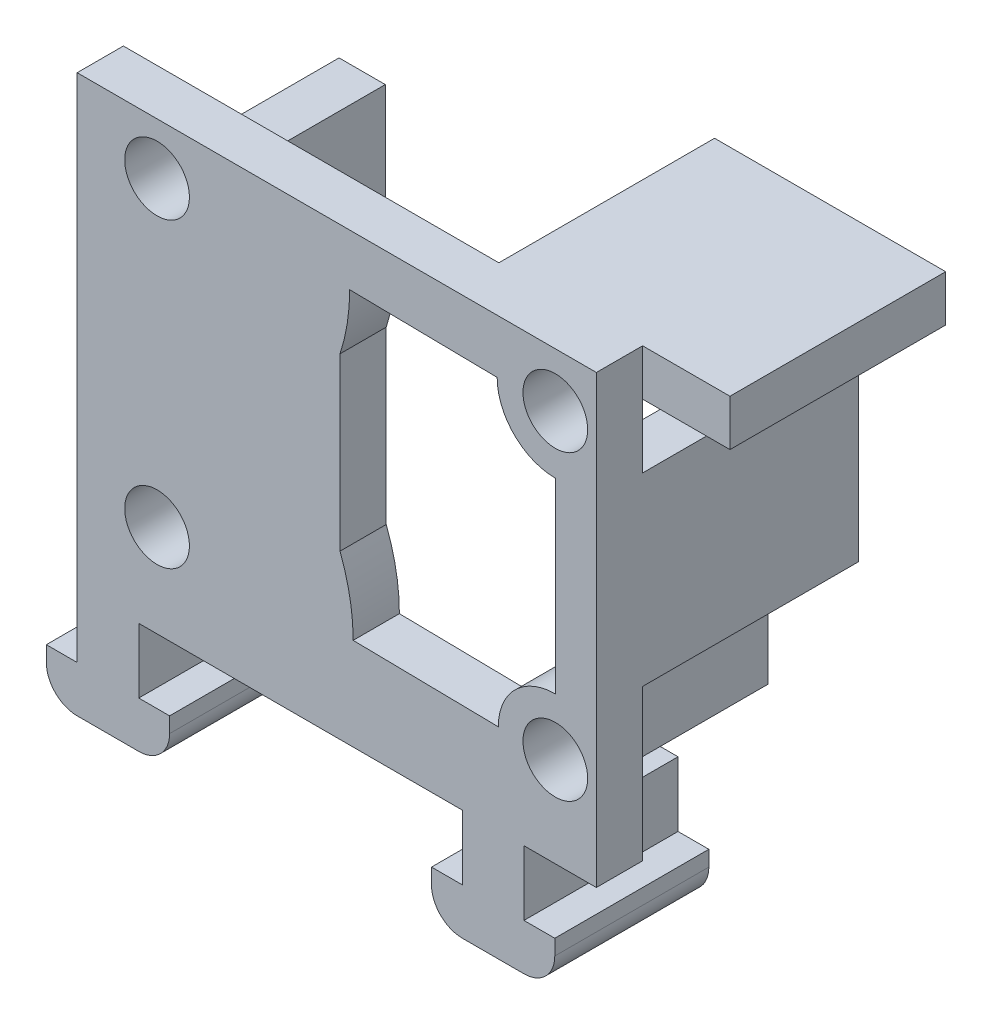
from build123d import *

# Parameters (mm, degrees)
EXTRUDE_1_DEPTH      = 2
EXTRUDE_1_DEPTH_BACK = 1
SKETCH_2_R           = 2.1
SKETCH_10_W          = 15
SKETCH_10_H          = 3
SKETCH_10_W_2        = 3
SKETCH_10_H_2        = 12
SKETCH_10_H_3        = 11.479623975
EXTRUDE_4_DEPTH      = 14
BOSS_EXTRUDE1_DEPTH  = 10
LPATTERN1_COUNT      = 2
LPATTERN1_PITCH      = 25
SKETCH2_W            = 3
SKETCH2_H            = 4
BOSS_EXTRUDE2_DEPTH  = 14
BOSS_EXTRUDE3_DEPTH  = 4
LPATTERN2_COUNT      = 2
LPATTERN2_PITCH      = 25


with BuildPart() as part:
    # Эскиз2 → Бобышка-Вытянуть1 (new, two sides: drawn at the far end of the back side and taken through both)
    with BuildSketch(Plane.XY.offset(-EXTRUDE_1_DEPTH_BACK)):
        Polygon((-17.059831088, 0), (-17.059831088, -2.25), (16.640168912, -2.25), (16.640168912, 0), (16.640168912, 26.7), (-17.059831088, 26.7), align=None)
        with Locations((13.974594116, 3.601530827)):
            Circle(SKETCH_2_R, mode=Mode.SUBTRACT)
        with Locations((13.974594116, 23.201353662)):
            Circle(SKETCH_2_R, mode=Mode.SUBTRACT)
        with Locations((-11.873187325, 23.347253317)):
            Circle(SKETCH_2_R, mode=Mode.SUBTRACT)
        with Locations((-11.873187325, 3.749999419)):
            Circle(SKETCH_2_R, mode=Mode.SUBTRACT)
        with BuildLine():
            Line((0, 19.427331525), (0, 8.33481378))
            ThreePointArc((0, 8.33481378), (0.6390244, 6.081878002), (0.854463675, 3.749999419))
            Line((0.854463675, 3.749999419), (10.273173279, 3.601530827))
            ThreePointArc((10.273173279, 3.601530827), (11.357294342, 6.218830601), (13.974594116, 7.302951664))
            Line((13.974594116, 7.302951664), (13.974594116, 19.427331525))
            ThreePointArc((13.974594116, 19.427331525), (11.305957471, 20.532717016), (10.200571979, 23.201353662))
            Line((10.200571979, 23.201353662), (0.63034674, 23.347253317))
            ThreePointArc((0.63034674, 23.347253317), (0.471754276, 21.36211328), (0, 19.427331525))
        make_face(mode=Mode.SUBTRACT)
    extrude(amount=EXTRUDE_1_DEPTH + EXTRUDE_1_DEPTH_BACK)

    # Эскиз10 → Бобышка-Вытянуть4 (add)
    with BuildSketch(Plane(origin=(0, 0, -1), x_dir=(-1, 0, 0), z_dir=(0, 0, -1))):
        with Locations((-14.81045997, 25.2)):
            Rectangle(SKETCH_10_W, SKETCH_10_H)
        with Locations((-15.140168912, 13.552877761)):
            Rectangle(SKETCH_10_W_2, SKETCH_10_H_2)
        with Locations((15.559831088, 13.292689749)):
            Rectangle(SKETCH_10_W_2, SKETCH_10_H_3)
    extrude(amount=EXTRUDE_4_DEPTH)

    # Sketch1 → Boss-Extrude1 (add)
    with BuildSketch(Plane.XY.offset(2)):
        with BuildLine():
            Line((-11.059831088, -6.45), (-13.059831088, -6.45))
            Line((-13.059831088, -6.45), (-13.059831088, -2.25))
            Line((-13.059831088, -2.25), (-17.059831088, -2.25))
            Line((-17.059831088, -2.25), (-17.059831088, -6.45))
            Line((-17.059831088, -6.45), (-19.059831088, -6.45))
            Line((-19.059831088, -6.45), (-19.059831088, -7.45))
            ThreePointArc((-19.059831088, -7.45), (-18.47404465, -8.864213562), (-17.059831088, -9.45))
            Line((-17.059831088, -9.45), (-13.059831088, -9.45))
            ThreePointArc((-13.059831088, -9.45), (-11.645617526, -8.864213562), (-11.059831088, -7.45))
            Line((-11.059831088, -7.45), (-11.059831088, -6.45))
        make_face()
    boss_extrude1 = extrude(amount=-BOSS_EXTRUDE1_DEPTH)

    # LPattern1: Boss-Extrude1 ×2
    with Locations(*[(i * LPATTERN1_PITCH, 0, 0) for i in range(1, LPATTERN1_COUNT)]):
        add(boss_extrude1)

    # Sketch2 → Boss-Extrude2 (add)
    with BuildSketch(Plane(origin=(0, 0, -1), x_dir=(-1, 0, 0), z_dir=(0, 0, -1))):
        with Locations((-9.283605158, -0.25)):
            Rectangle(SKETCH2_W, SKETCH2_H)
    extrude(amount=BOSS_EXTRUDE2_DEPTH)

    # Sketch3 → Boss-Extrude3 (add)
    with BuildSketch(Plane.ZY.offset(-7.940168912)):
        Polygon((-4.5, -2.25), (-1, -2.25), (-1, 0.558861968), align=None)
    boss_extrude3 = extrude(amount=-BOSS_EXTRUDE3_DEPTH)

    # LPattern2: Boss-Extrude3 ×2
    with Locations(*[(-i * LPATTERN2_PITCH, 0, 0) for i in range(1, LPATTERN2_COUNT)]):
        add(boss_extrude3)


solid = part.part
